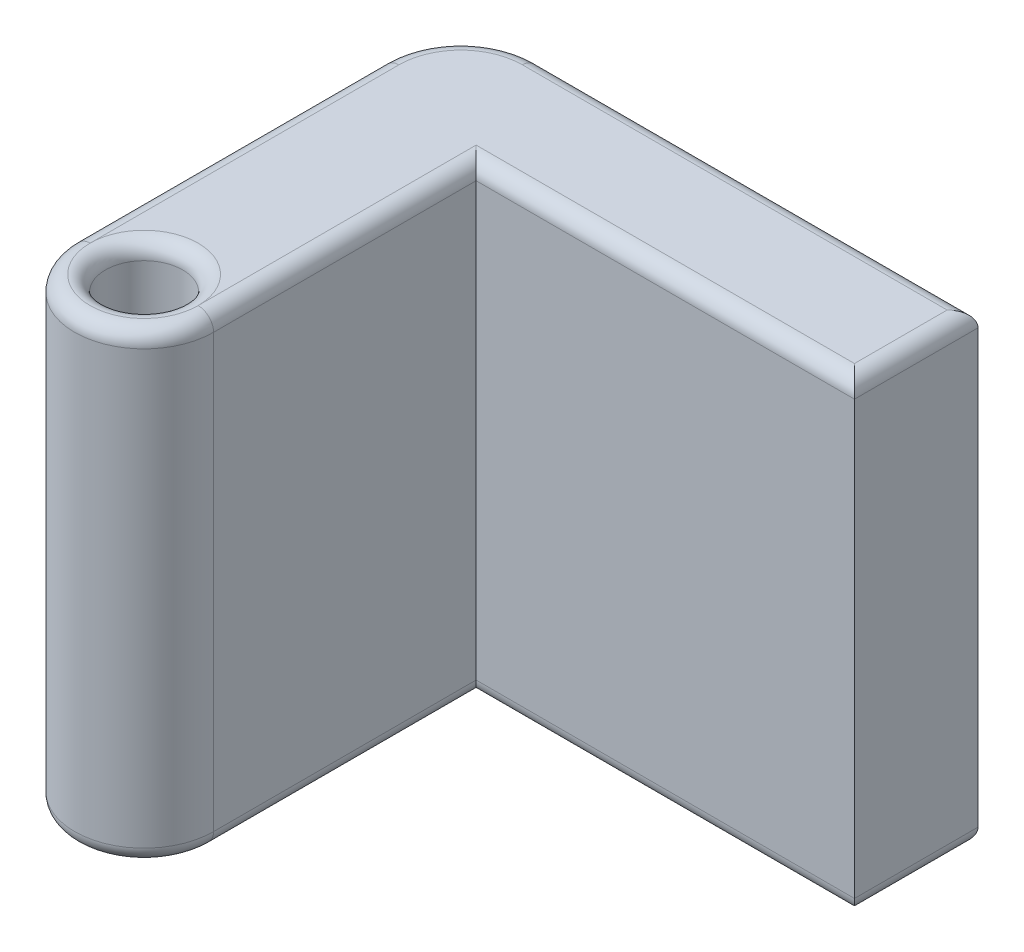
from build123d import *

# Parameters (mm, degrees)
SKETCH1_R           = 2.5
BOSS_EXTRUDE1_DEPTH = 30
FILLET1_R           = 1
FILLET2_R           = 5


# Some blends are built 0.0001 mm under size
with BuildPart() as part:
    # Sketch1 → Boss-Extrude1 (new body)
    with BuildSketch(Plane(origin=(0, 0, 0), x_dir=(1, 0, 0), z_dir=(0, 1, 0))):
        with BuildLine():
            Line((0, 0), (-33.5, 0))
            Line((-33.5, 0), (-33.5, -25))
            ThreePointArc((-33.5, -25), (-29, -29.5), (-24.5, -25))
            Line((-24.5, -25), (-24.5, -8))
            Line((-24.5, -8), (0, -8))
            Line((0, -8), (0, 0))
        make_face()
        with Locations(Location((-29, -25, 0), (0, 0, 270))):
            Circle(SKETCH1_R, mode=Mode.SUBTRACT)
    extrude(amount=BOSS_EXTRUDE1_DEPTH)

    # Fillet1
    fillet1_edges = [part.edges().sort_by_distance(p)[0] for p in [
        (-33.5, 30, 12.5),
        (-29, 30, 29.5),
        (-29, 0, 22.5),
        (-29, 30, 22.5),
        (-24.5, 30, 16.5),
        (-12.25, 30, 8),
        (0, 30, 4),
        (-12.25, 0, 8),
        (-24.5, 0, 16.5),
        (-29, 0, 29.5),
        (-33.5, 0, 12.5),
        (-16.75, 0, 0),
        (0, 0, 4),
        (-16.75, 30, 0),
    ]]
    fillet(fillet1_edges, radius=FILLET1_R - 0.0001)  # a hair under: the kernel refuses the full size

    # Fillet2
    # the kernel refuses this fillet: 5 mm, written as the material it takes off along each edge
    with BuildSketch(Plane(origin=(-28.5, 0, 5), x_dir=(-1, 0, 0), z_dir=(0, 0, 1))) as fillet2_piece_1:
        with BuildLine():
            CenterArc((4.0001, -0.9999), 0.9999, 0, 90)
            Line((5, -0.9999), (5, 0))
            Line((5, 0), (4.0001, 0))
        make_face()
    revolve(axis=Axis((-28.5, 0, 5), (0, -1, 0)), revolution_arc=90, mode=Mode.SUBTRACT)
    with BuildSketch(Plane(origin=(-28.5, 30, 5), x_dir=(0, 0, -1), z_dir=(1, 0, 0))) as fillet2_piece_2:
        with BuildLine():
            CenterArc((4.0001, -0.9999), 0.9999, 0, 90)
            Line((5, -0.9999), (5, 0))
            Line((5, 0), (4.0001, 0))
        make_face()
    revolve(axis=Axis((-28.5, 30, 5), (0, 1, 0)), revolution_arc=90, mode=Mode.SUBTRACT)
    with BuildSketch(Plane(origin=(-33.5, 0, 0), x_dir=(1, 0, 0), z_dir=(0, 1, 0))) as fillet2_piece_3:
        with BuildLine():
            CenterArc((FILLET2_R, -FILLET2_R), FILLET2_R, 90, 90)
            Line((0, -FILLET2_R), (0, 0))
            Line((0, 0), (FILLET2_R, 0))
        make_face()
    extrude(amount=30, mode=Mode.SUBTRACT)


solid = part.part
